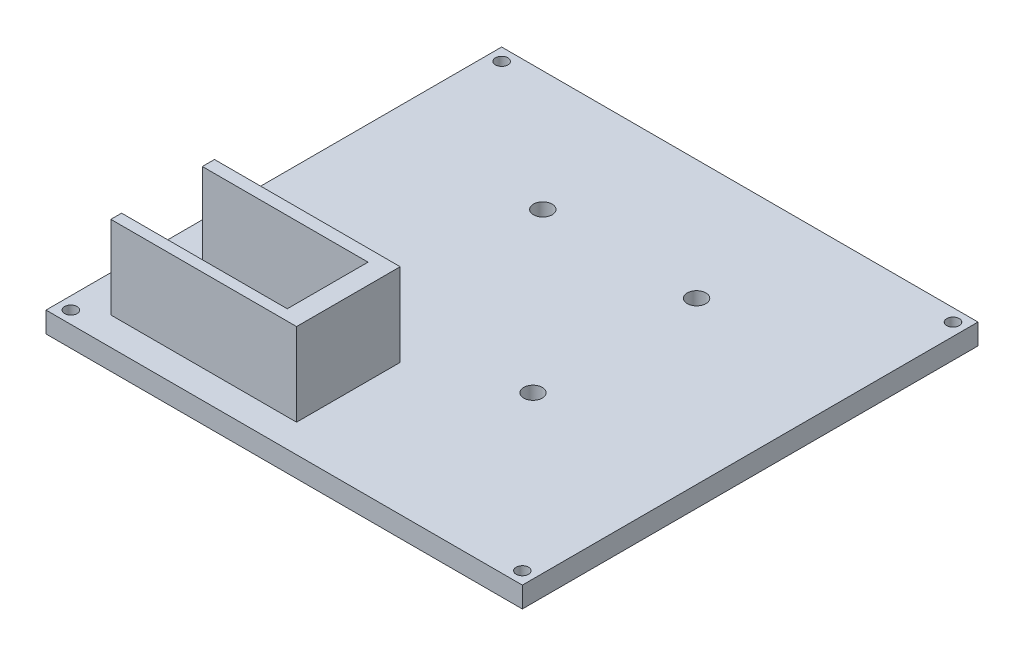
from build123d import *

# Parameters (mm, degrees)
SKETCH1_W           = 115
SKETCH1_H           = 110
SKETCH1_R           = 1.5
BOSS_EXTRUDE1_DEPTH = 5
BOSS_EXTRUDE3_DEPTH = 20
SKETCH4_8_R         = 2.25
CUT_EXTRUDE1_DEPTH  = 5


with BuildPart() as part:
    # Sketch1 → Boss-Extrude1 (new body)
    with BuildSketch(Plane(origin=(0, 0, 0), x_dir=(1, 0, 0), z_dir=(0, 1, 0))):
        with Locations((-8.316561338, -18.5729224)):
            Rectangle(SKETCH1_W, SKETCH1_H)
        with Locations((-62.816561338, 33.4270776)):
            Circle(SKETCH1_R, mode=Mode.SUBTRACT)
        with Locations((46.183438662, 33.394052045)):
            Circle(SKETCH1_R, mode=Mode.SUBTRACT)
        with Locations((-62.816561338, -70.5729224)):
            Circle(SKETCH1_R, mode=Mode.SUBTRACT)
        with Locations((46.183438662, -70.5729224)):
            Circle(SKETCH1_R, mode=Mode.SUBTRACT)
    extrude(amount=BOSS_EXTRUDE1_DEPTH)

    # Sketch4 → Boss-Extrude3 (add)
    with BuildSketch(Plane(origin=(0, 5, 0), x_dir=(1, 0, 0), z_dir=(0, 1, 0))):
        Polygon((-16.96183969, -64.18172288), (-56.96183969, -64.18172288), (-56.96183969, -66.77546835), (-12.125133956, -66.77546835), (-12.125133956, -41.753453233), (-56.96183969, -41.753453233), (-56.96183969, -44.68172288), (-16.96183969, -44.68172288), align=None)
    extrude(amount=BOSS_EXTRUDE3_DEPTH)

    # Sketch4<8> → Cut-Extrude1 (cut)
    with BuildSketch(Plane(origin=(0, 5, 0), x_dir=(1, 0, 0), z_dir=(0, 1, 0))):
        with Locations((-26.882599074, -32.0729224)):
            Circle(SKETCH4_8_R)
        with Locations((10.253438662, 7.4270776)):
            Circle(SKETCH4_8_R)
        with Locations((-26.882599074, 7.4270776)):
            Circle(SKETCH4_8_R)
        with Locations((10.253438662, -32.0729224)):
            Circle(SKETCH4_8_R)
    extrude(amount=-CUT_EXTRUDE1_DEPTH, mode=Mode.SUBTRACT)


solid = part.part
